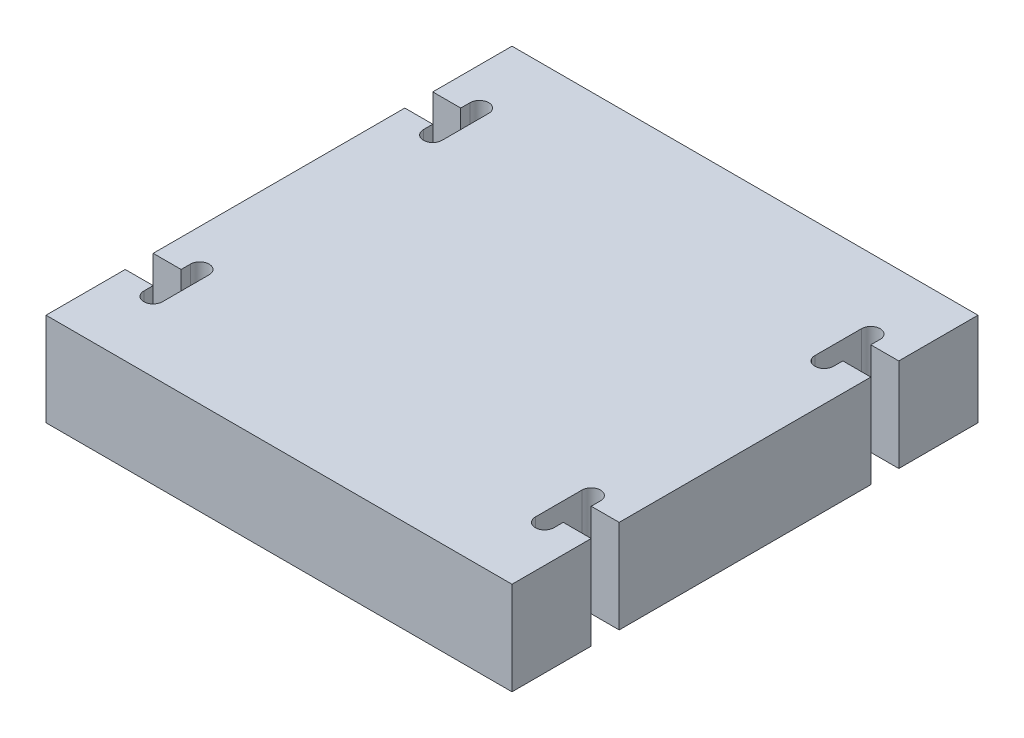
from build123d import *

# Parameters (mm, degrees)
BOSS_EXTRUDE1_DEPTH      = 5
BOSS_EXTRUDE1_DEPTH_BACK = 5
SKETCH1_W                = 50
SKETCH1_H                = 50
CUT_EXTRUDE1_DEPTH       = 10


with BuildPart() as part:
    # Sketch1 → Boss-Extrude1 (new, two sides: drawn at the far end of the back side and taken through both)
    with BuildSketch(Plane(origin=(0, 0, 0), x_dir=(1, 0, 0), z_dir=(0, 1, 0)).offset(-BOSS_EXTRUDE1_DEPTH_BACK)):
        Rectangle(SKETCH1_W, SKETCH1_H)
    extrude(amount=BOSS_EXTRUDE1_DEPTH + BOSS_EXTRUDE1_DEPTH_BACK)

    # Sketch2 → Cut-Extrude1 (cut)
    with BuildSketch(Plane(origin=(0, 5, 0), x_dir=(-1, 0, 0), z_dir=(0, 1, 0))):
        with BuildLine():
            Line((25, -16.5), (25, -13.5))
            Line((25, -13.5), (22, -13.5))
            Line((22, -13.5), (22, -12.5))
            ThreePointArc((22, -12.5), (21, -11.5), (20, -12.5))
            Line((20, -12.5), (20, -17.5))
            ThreePointArc((20, -17.5), (21, -18.5), (22, -17.5))
            Line((22, -17.5), (22, -16.5))
            Line((22, -16.5), (25, -16.5))
        make_face()
        with BuildLine():
            Line((22, 13.5), (25, 13.5))
            Line((25, 13.5), (25, 16.5))
            Line((25, 16.5), (22, 16.5))
            Line((22, 16.5), (22, 17.5))
            ThreePointArc((22, 17.5), (21, 18.5), (20, 17.5))
            Line((20, 17.5), (20, 12.5))
            ThreePointArc((20, 12.5), (21, 11.5), (22, 12.5))
            Line((22, 12.5), (22, 13.5))
        make_face()
    cut_extrude1 = extrude(amount=-CUT_EXTRUDE1_DEPTH, mode=Mode.SUBTRACT)

    # Mirror1: Cut-Extrude1 across plane
    add(cut_extrude1.mirror(Plane(origin=(0, 0, 0), x_dir=(0, 0, 1), z_dir=(1, 0, 0))), mode=Mode.SUBTRACT)


solid = part.part
